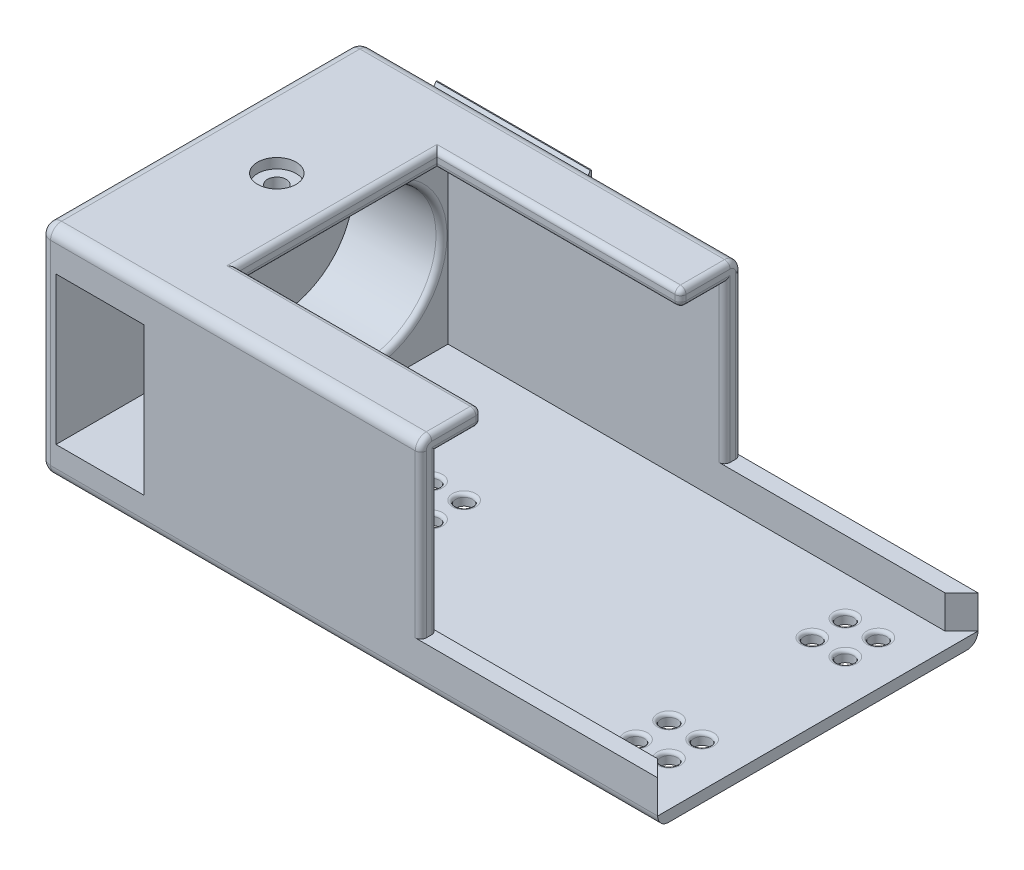
from build123d import *

# Parameters (mm, degrees)
SKETCH1_W            = 48.1
SKETCH1_H            = 29.075
BOSS_EXTRUDE1_DEPTH  = 1
BOSS_EXTRUDE3_DEPTH  = 3
BOSS_EXTRUDE4_START  = -3
BOSS_EXTRUDE4_DEPTH  = 17.2
SKETCH7_W            = 26.6
SKETCH7_H            = 29.075
BOSS_EXTRUDE5_DEPTH  = 1.5
CUT_EXTRUDE2_DEPTH   = 1.5
BOSS_EXTRUDE8_START  = 6.5
BOSS_EXTRUDE8_DEPTH  = 6.5
SKETCH18_W           = 29.075
SKETCH18_H           = 19.7
BOSS_EXTRUDE9_DEPTH  = 1.5
SKETCH19_W           = 22.1
SKETCH19_H           = 18.075
CUT_EXTRUDE3_DEPTH   = 1.5
FILLET2_R            = 1
FILLET3_R            = 0.5
FILLET4_R            = 0.5
SKETCH20_R           = 0.85
CUT_EXTRUDE4_DEPTH   = 17.8
SKETCH22_R           = 0.75
CUT_EXTRUDE5_DEPTH   = 1
SKETCH23_R           = 1.75
CUT_EXTRUDE6_DEPTH   = 0.9
FILLET6_R            = 0.3
FILLET7_R            = 0.5
SKETCH24_W           = 14
SKETCH24_H           = 2
BOSS_EXTRUDE10_DEPTH = 6
SKETCH25_R           = 3.1
CUT_EXTRUDE7_DEPTH   = 14
BOSS_EXTRUDE11_DEPTH = 14


with BuildPart() as part:
    # Sketch1 → Boss-Extrude1 (new body)
    with BuildSketch(Plane(origin=(0, 0, 0), x_dir=(1, 0, 0), z_dir=(0, 1, 0))):
        with Locations((-3.958134154, -3.793142446)):
            Rectangle(SKETCH1_W, SKETCH1_H)
    extrude(amount=BOSS_EXTRUDE1_DEPTH)

    # Sketch3 → Boss-Extrude3 (add)
    with BuildSketch(Plane(origin=(0, 1, 0), x_dir=(1, 0, 0), z_dir=(0, 1, 0))):
        Polygon((-26.508134154, 9.244357554), (18.591865846, 9.244357554), (20.091865846, 10.744357554), (-28.008134154, 10.744357554), (-28.008134154, -18.330642446), (20.091865846, -18.330642446), (18.591865846, -16.830642446), (-26.508134154, -16.830642446), align=None)
    extrude(amount=BOSS_EXTRUDE3_DEPTH)

    # Sketch6 → Boss-Extrude4 (add)
    with BuildSketch(Plane(origin=(0, 4, 0), x_dir=(1, 0, 0), z_dir=(0, 1, 0)).offset(BOSS_EXTRUDE4_START)):
        Polygon((-28.008134154, 10.744357554), (-1.408134154, 10.744357554), (-1.408134154, 9.244357554), (-26.508134154, 9.244357554), (-26.508134154, -16.830642446), (-1.408134154, -16.830642446), (-1.408134154, -18.330642446), (-28.008134154, -18.330642446), align=None)
    extrude(amount=BOSS_EXTRUDE4_DEPTH)

    # Sketch7 → Boss-Extrude5 (add)
    with BuildSketch(Plane(origin=(0, 18.2, 0), x_dir=(1, 0, 0), z_dir=(0, 1, 0))):
        with Locations((-14.708134154, -3.793142446)):
            Rectangle(SKETCH7_W, SKETCH7_H)
    extrude(amount=BOSS_EXTRUDE5_DEPTH)

    # Sketch8 → Cut-Extrude2 (cut)
    with BuildSketch(Plane.ZY.offset(28.008134154)):
        with BuildLine():
            Line((-1.956857554, 16.3), (9.543142446, 16.3))
            Line((9.543142446, 16.3), (18.330642446, 16.3))
            Line((18.330642446, 16.3), (18.330642446, 2.9))
            Line((18.330642446, 2.9), (9.543142446, 2.9))
            Line((9.543142446, 2.9), (-1.956857554, 2.9))
            ThreePointArc((-1.956857554, 2.9), (-8.656857554, 9.6), (-1.956857554, 16.3))
        make_face()
    extrude(amount=-CUT_EXTRUDE2_DEPTH, mode=Mode.SUBTRACT)

    # Sketch17 → Boss-Extrude8 (add)
    with BuildSketch(Plane.ZY.offset(28.008134154).offset(BOSS_EXTRUDE8_START)):
        with BuildLine():
            Line((18.330642446, 2.9), (-1.956857554, 2.9))
            ThreePointArc((-1.956857554, 2.9), (-8.656857554, 9.6), (-1.956857554, 16.3))
            Line((-1.956857554, 16.3), (18.330642446, 16.3))
            Line((18.330642446, 16.3), (18.330642446, 19.7))
            Line((18.330642446, 19.7), (-10.744357554, 19.7))
            Line((-10.744357554, 19.7), (-10.744357554, 0))
            Line((-10.744357554, 0), (18.330642446, 0))
            Line((18.330642446, 0), (18.330642446, 2.9))
        make_face()
    extrude(amount=-BOSS_EXTRUDE8_DEPTH)

    # Sketch18 → Boss-Extrude9 (add)
    with BuildSketch(Plane.ZY.offset(34.508134154)):
        with Locations((3.793142446, 9.85)):
            Rectangle(SKETCH18_W, SKETCH18_H)
    extrude(amount=BOSS_EXTRUDE9_DEPTH)

    # Sketch19 → Cut-Extrude3 (cut)
    with BuildSketch(Plane(origin=(0, 19.7, 0), x_dir=(1, 0, 0), z_dir=(0, 1, 0))):
        with Locations((-12.458134154, -3.793142446)):
            Rectangle(SKETCH19_W, SKETCH19_H)
    extrude(amount=-CUT_EXTRUDE3_DEPTH, mode=Mode.SUBTRACT)

    # Fillet2
    fillet2_edges = [part.edges().sort_by_distance(p)[0] for p in [
        (-36.008134154, 0, 3.793142446),
        (-36.008134154, 19.7, 3.793142446),
        (-36.008134154, 9.85, -10.744357554),
        (-18.708134154, 19.7, -10.744357554),
        (-7.958134154, 0, -10.744357554),
        (-7.958134154, 0, 18.330642446),
        (-36.008134154, 9.85, 18.330642446),
        (-18.708134154, 19.7, 18.330642446),
    ]]
    fillet(fillet2_edges, radius=FILLET2_R)

    # Fillet3
    fillet3_edges = [part.edges().sort_by_distance(p)[0] for p in [
        (-1.408134154, 18.2, -7.244357554),
        (-1.408134154, 19.7, -7.494357554),
        (-12.458134154, 18.2, 12.830642446),
        (-12.458134154, 19.7, 12.830642446),
        (-12.458134154, 19.7, -5.244357554),
        (-23.508134154, 19.7, 3.793142446),
        (-23.508134154, 18.2, 3.793142446),
        (-12.458134154, 18.2, -5.244357554),
        (-1.408134154, 19.7, 15.080642446),
        (-1.408134154, 11.35, -10.744357554),
        (-1.408134154, 19.407106781, -10.451464335),
        (-1.408134154, 11.35, 18.330642446),
        (-1.408134154, 19.407106781, 18.037749227),
        (-1.408134154, 11.1, -9.244357554),
        (-1.408134154, 11.1, 16.830642446),
        (-1.408134154, 18.2, 14.830642446),
    ]]
    fillet(fillet3_edges, radius=FILLET3_R)

    # Fillet4
    fillet4_edges = [part.edges().sort_by_distance(p)[0] for p in [
        (-26.508134154, 9.6, -8.656857554),
        (-26.508134154, 16.3, 7.436892446),
        (-26.508134154, 2.9, 7.436892446),
    ]]
    fillet(fillet4_edges, radius=FILLET4_R)

    # Sketch20 → Cut-Extrude4 (cut)
    with BuildSketch(Plane(origin=(0, 19.7, 0), x_dir=(1, 0, 0), z_dir=(0, 1, 0))):
        with Locations(Location((-29.008134154, -3.793142446, 0), (0, 0, 90))):
            Circle(SKETCH20_R)
    extrude(amount=-CUT_EXTRUDE4_DEPTH, mode=Mode.SUBTRACT)

    # Sketch22 → Cut-Extrude5 (cut)
    with BuildSketch(Plane(origin=(0, 1, 0), x_dir=(1, 0, 0), z_dir=(0, 1, 0))):
        with Locations(Location((13.091865846, 2.704357554, 0), (0, 0, 270))):
            Circle(SKETCH22_R)
        with Locations(Location((16.091865846, 2.704357554, 0), (0, 0, 270))):
            Circle(SKETCH22_R)
        with Locations(Location((16.091865846, 5.704357554, 0), (0, 0, 270))):
            Circle(SKETCH22_R)
        with Locations(Location((13.091865846, 5.704357554, 0), (0, 0, 270))):
            Circle(SKETCH22_R)
        with Locations(Location((16.091865846, -10.295642446, 0), (0, 0, 270))):
            Circle(SKETCH22_R)
        with Locations(Location((16.091865846, -13.295642446, 0), (0, 0, 270))):
            Circle(SKETCH22_R)
        with Locations(Location((13.091865846, -10.295642446, 0), (0, 0, 270))):
            Circle(SKETCH22_R)
        with Locations(Location((13.091865846, -13.295642446, 0), (0, 0, 270))):
            Circle(SKETCH22_R)
        with Locations(Location((-13.508134154, -2.295642446, 0), (0, 0, 270))):
            Circle(SKETCH22_R)
        with Locations(Location((-13.508134154, -5.295642446, 0), (0, 0, 270))):
            Circle(SKETCH22_R)
        with Locations(Location((-16.508134154, -5.295642446, 0), (0, 0, 270))):
            Circle(SKETCH22_R)
        with Locations(Location((-16.508134154, -2.295642446, 0), (0, 0, 270))):
            Circle(SKETCH22_R)
    extrude(amount=-CUT_EXTRUDE5_DEPTH, mode=Mode.SUBTRACT)

    # Sketch23 → Cut-Extrude6 (cut)
    with BuildSketch(Plane(origin=(0, 19.7, 0), x_dir=(1, 0, 0), z_dir=(0, 1, 0))):
        with Locations(Location((-29.008134154, -3.793142446, 0), (0, 0, 270))):
            Circle(SKETCH23_R)
    extrude(amount=-CUT_EXTRUDE6_DEPTH, mode=Mode.SUBTRACT)

    # Fillet6
    fillet6_edges = [part.edges().sort_by_distance(p)[0] for p in [
        (16.091865846, 1, 12.545642446),
        (13.091865846, 1, 9.545642446),
        (13.091865846, 1, 12.545642446),
        (-13.508134154, 1, 1.545642446),
        (13.091865846, 1, -3.454357554),
        (16.091865846, 1, -6.454357554),
        (13.091865846, 1, -6.454357554),
        (16.091865846, 1, 9.545642446),
        (-13.508134154, 1, 4.545642446),
        (-16.508134154, 1, 4.545642446),
        (-16.508134154, 1, 1.545642446),
        (16.091865846, 1, -3.454357554),
    ]]
    fillet(fillet6_edges, radius=FILLET6_R)

    # Fillet7
    # the kernel refuses this fillet: 0.5 mm, written as the material it takes off along each edge
    with BuildSketch(Plane(origin=(-1.908134154, 19.2, 13.330642446), x_dir=(0, 0, -1), z_dir=(1, 0, 0))) as fillet7_piece_1_section:
        Polygon((0, 0), (FILLET7_R, 0), (FILLET7_R, FILLET7_R), (0, FILLET7_R), align=None)
    fillet7_piece_1 = extrude(amount=FILLET7_R, mode=Mode.PRIVATE)
    fillet7_piece_1 = fillet7_piece_1 - Plane(origin=(-1.908134154, 19.2, 13.330642446), x_dir=(0, -0.7071067811865475, 0.7071067811865475), z_dir=(1, 0, 0)) * Sphere(FILLET7_R, mode=Mode.PRIVATE)
    add(fillet7_piece_1, mode=Mode.SUBTRACT)
    with BuildSketch(Plane(origin=(-1.908134154, 19.2, -5.744357554), x_dir=(0, 0, 1), z_dir=(1, 0, 0))) as fillet7_piece_2_section:
        Polygon((0, 0), (FILLET7_R, 0), (FILLET7_R, -FILLET7_R), (0, -FILLET7_R), align=None)
    fillet7_piece_2 = extrude(amount=FILLET7_R, mode=Mode.PRIVATE)
    fillet7_piece_2 = fillet7_piece_2 - Plane(origin=(-1.908134154, 19.2, -5.744357554), x_dir=(0, -0.7071067811865475, -0.7071067811865475), z_dir=(1, 0, 0)) * Sphere(FILLET7_R, mode=Mode.PRIVATE)
    add(fillet7_piece_2, mode=Mode.SUBTRACT)
    with BuildSketch(Plane(origin=(-1.908134154, 18.7, 13.330642446), x_dir=(0, 0, -1), z_dir=(1, 0, 0))) as fillet7_piece_3_section:
        Polygon((0, 0), (FILLET7_R, 0), (FILLET7_R, -FILLET7_R), (0, -FILLET7_R), align=None)
    fillet7_piece_3 = extrude(amount=FILLET7_R, mode=Mode.PRIVATE)
    fillet7_piece_3 = fillet7_piece_3 - Plane(origin=(-1.908134154, 18.7, 13.330642446), x_dir=(0, 0.7071067811865475, 0.7071067811865475), z_dir=(1, 0, 0)) * Sphere(FILLET7_R, mode=Mode.PRIVATE)
    add(fillet7_piece_3, mode=Mode.SUBTRACT)
    with BuildSketch(Plane(origin=(-1.908134154, 18.7, -5.744357554), x_dir=(0, 0, 1), z_dir=(1, 0, 0))) as fillet7_piece_4_section:
        Polygon((0, 0), (FILLET7_R, 0), (FILLET7_R, FILLET7_R), (0, FILLET7_R), align=None)
    fillet7_piece_4 = extrude(amount=FILLET7_R, mode=Mode.PRIVATE)
    fillet7_piece_4 = fillet7_piece_4 - Plane(origin=(-1.908134154, 18.7, -5.744357554), x_dir=(0, 0.7071067811865475, -0.7071067811865475), z_dir=(1, 0, 0)) * Sphere(FILLET7_R, mode=Mode.PRIVATE)
    add(fillet7_piece_4, mode=Mode.SUBTRACT)
    with BuildSketch(Plane(origin=(-1.408134154, 19.2, -5.244357554), x_dir=(0, 0, -1), z_dir=(0, -1, 0))) as fillet7_piece_5:
        with BuildLine():
            CenterArc((FILLET7_R, -FILLET7_R), FILLET7_R, 90, 90)
            Line((0, -FILLET7_R), (0, 0))
            Line((0, 0), (FILLET7_R, 0))
        make_face()
    extrude(amount=0.5, mode=Mode.SUBTRACT)
    with BuildSketch(Plane(origin=(-1.408134154, 19.2, 12.830642446), x_dir=(0, 0, 1), z_dir=(0, -1, 0))) as fillet7_piece_6:
        with BuildLine():
            CenterArc((FILLET7_R, FILLET7_R), FILLET7_R, 180, 90)
            Line((0, FILLET7_R), (0, 0))
            Line((0, 0), (FILLET7_R, 0))
        make_face()
    extrude(amount=0.5, mode=Mode.SUBTRACT)

    # Sketch24 → Boss-Extrude10 (add)
    with BuildSketch(Plane(origin=(0, 0, -10.744357554), x_dir=(-1, 0, 0), z_dir=(0, 0, -1))):
        with Locations((28.008134154, 12.7)):
            Rectangle(SKETCH24_W, SKETCH24_H)
    extrude(amount=BOSS_EXTRUDE10_DEPTH)

    # Sketch25 → Cut-Extrude7 (cut)
    with BuildSketch(Plane.ZY.offset(35.008134154)):
        with Locations((-13.944357554, 15.2)):
            Circle(SKETCH25_R)
    extrude(amount=-CUT_EXTRUDE7_DEPTH, mode=Mode.SUBTRACT)

    # Sketch27 → Boss-Extrude11 (add)
    with BuildSketch(Plane.ZY.offset(35.008134154)):
        Polygon((-16.744357554, 11.7), (-10.744357554, 1), (-10.744357554, 11.7), align=None)
    extrude(amount=-BOSS_EXTRUDE11_DEPTH)


solid = part.part
